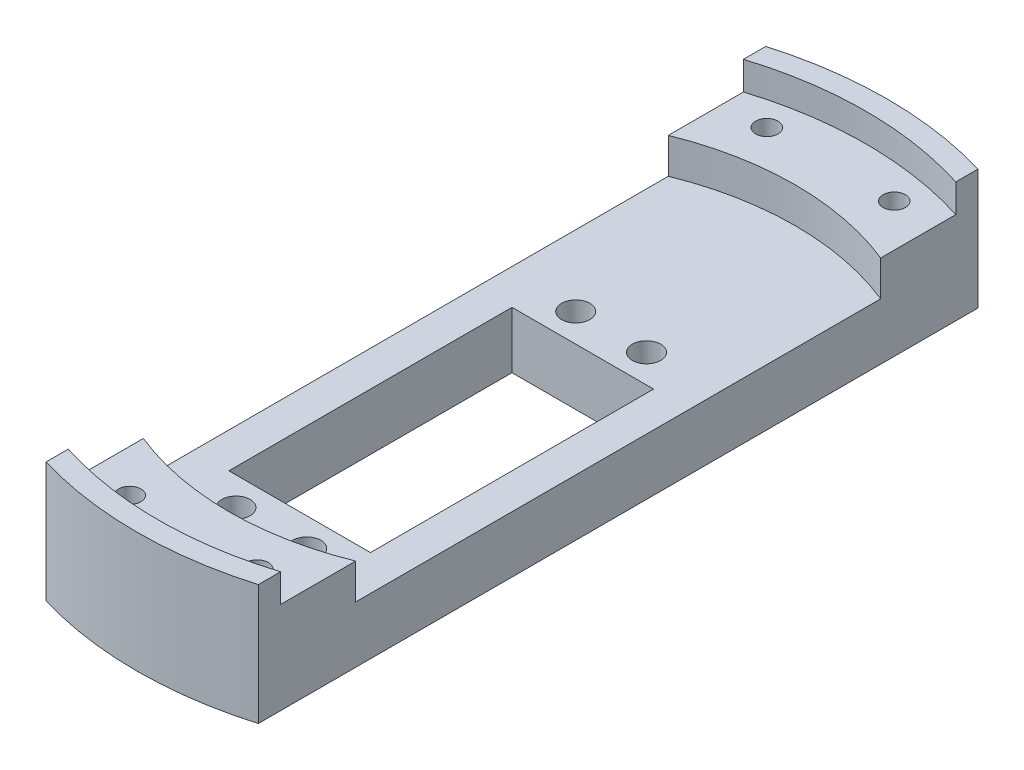
from build123d import *

# Parameters (mm, degrees)
SKETCH_1_R                  = 2
SKETCH_1_W                  = 20
SKETCH_1_H                  = 40
EXTRUDE_1_DEPTH             = 8
EXTRUDE_2_DEPTH             = 5
HOLE_WIZARD_M31_D           = 3.15
PATTERN_LINEAR_1_COUNT      = 2
PATTERN_LINEAR_1_PITCH      = 18
PATTERN_LINEAR_1_COUNT_DIR2 = 2
PATTERN_LINEAR_1_PITCH_DIR2 = 90
EXTRUDE_3_DEPTH             = 4


with BuildPart() as part:
    # Эскиз1 → Бобышка-Вытянуть1 (new body)
    with BuildSketch(Plane(origin=(0, 0, 0), x_dir=(1, 0, 0), z_dir=(0, 1, 0))):
        with BuildLine():
            Line((-15, -50.833060109), (-15, 50.833060109))
            ThreePointArc((-15, 50.833060109), (0, 53), (15, 50.833060109))
            Line((15, 50.833060109), (15, -50.833060109))
            ThreePointArc((15, -50.833060109), (0, -53), (-15, -50.833060109))
        make_face()
        with Locations((-5, -34)):
            Circle(SKETCH_1_R, mode=Mode.SUBTRACT)
        with Locations((5, -34)):
            Circle(SKETCH_1_R, mode=Mode.SUBTRACT)
        with Locations((5, 14)):
            Circle(SKETCH_1_R, mode=Mode.SUBTRACT)
        with Locations((-5, 14)):
            Circle(SKETCH_1_R, mode=Mode.SUBTRACT)
        with Locations((0, -10)):
            Rectangle(SKETCH_1_W, SKETCH_1_H, mode=Mode.SUBTRACT)
    extrude(amount=EXTRUDE_1_DEPTH)

    # Эскиз2 → Бобышка-Вытянуть2 (add)
    with BuildSketch(Plane(origin=(0, 8, 0), x_dir=(1, 0, 0), z_dir=(0, 1, 0))):
        with BuildLine():
            Line((-15, 37.080992435), (-15, 50.833060109))
            ThreePointArc((-15, 50.833060109), (0, 53), (15, 50.833060109))
            Line((15, 50.833060109), (15, 37.080992435))
            ThreePointArc((15, 37.080992435), (0, 40), (-15, 37.080992435))
        make_face()
        with BuildLine():
            Line((-15, -37.080992435), (-15, -50.833060109))
            ThreePointArc((-15, -50.833060109), (0, -53), (15, -50.833060109))
            Line((15, -50.833060109), (15, -37.080992435))
            ThreePointArc((15, -37.080992435), (0, -40), (-15, -37.080992435))
        make_face()
    extrude(amount=EXTRUDE_2_DEPTH)

    # Сверло под метчик  спиральное M31 (through all)
    with Locations(Plane(origin=(0, 13, 0), x_dir=(1, 0, 0), z_dir=(0, 1, 0))):
        with Locations((-9, -45)):
            hole_wizard_m31 = Hole(HOLE_WIZARD_M31_D / 2)

    # Линейный массив1: Hole Wizard M31 2 × 2
    with Locations(*[(i * PATTERN_LINEAR_1_PITCH, 0, -j * PATTERN_LINEAR_1_PITCH_DIR2) for i in range(PATTERN_LINEAR_1_COUNT) for j in range(PATTERN_LINEAR_1_COUNT_DIR2) if (i, j) != (0, 0)]):
        add(hole_wizard_m31, mode=Mode.SUBTRACT)

    # Эскиз9 → Бобышка-Вытянуть3 (add)
    with BuildSketch(Plane(origin=(0, 13, 0), x_dir=(1, 0, 0), z_dir=(0, 1, 0))):
        with BuildLine():
            Line((-15, 50.833060109), (-15, 47.696960071))
            ThreePointArc((-15, 47.696960071), (0, 50), (15, 47.696960071))
            Line((15, 47.696960071), (15, 50.833060109))
            ThreePointArc((15, 50.833060109), (0, 53), (-15, 50.833060109))
        make_face()
        with BuildLine():
            Line((-15, -50.833060109), (-15, -47.696960071))
            ThreePointArc((-15, -47.696960071), (0, -50), (15, -47.696960071))
            Line((15, -47.696960071), (15, -50.833060109))
            ThreePointArc((15, -50.833060109), (0, -53), (-15, -50.833060109))
        make_face()
    extrude(amount=EXTRUDE_3_DEPTH)


solid = part.part
